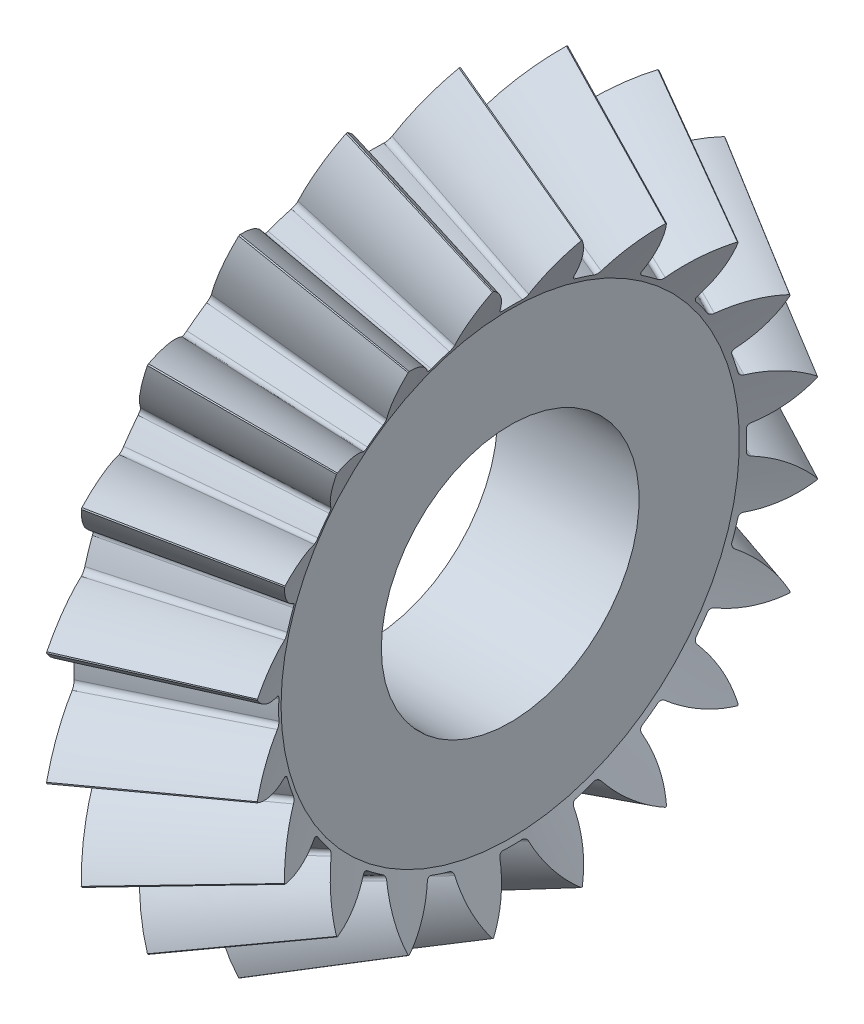
from build123d import *

# Parameters (mm, degrees)
TEETHCUTS_COUNT = 20
TEETHCUTS_ANGLE = 342
HUBSKE_R        = 22.642625335
HUB_DEPTH       = 0.0001016
BORSKE_R        = 10
BORE_DEPTH      = 51.178738133


with BuildPart() as part:
    # BasProSke → Base-Revolve (revolve)
    with BuildSketch(Plane(origin=(0, 0, 0), x_dir=(1, 0, 0), z_dir=(0, 1, 0)), mode=Mode.PRIVATE) as base_revolve_sk:
        Polygon((0, 0), (0, 22.642625335), (2.68244305, 28.007511429), (13.092769339, 21.995348277), (10.98614629, 17.782102184), (10.98614629, 0), align=None)
    revolve(base_revolve_sk.sketch.rotate(Axis((-10, 0, 0), (1, 0, 0)), 180), axis=Axis((-10, 0, 0), (1, 0, 0)))

    # ToothCut: read off the stored shape, not the designer's step
    # ToothCut: loft between two sections, ruled curve by curve
    toothcut_from = [
        Edge.make_bspline([(51.18205457, 0.006734473, -0.010227324), (51.179496811, 0.001618955, -0.014437914), (51.176344194, -0.00468628, -0.013574922), (51.174316199, -0.00874227, -0.008109037)], [0, 0, 0, 0, 1, 1, 1, 1], 3, [1, 0.818195495, 0.818195495, 1]),
        Edge.make_bspline([(51.174316199, -0.00874227, 0.008109037), (51.176344194, -0.00468628, 0.013574922), (51.179496811, 0.001618955, 0.014437914), (51.18205457, 0.006734473, 0.010227324)], [0, 0, 0, 0, 1, 1, 1, 1], 3, [1, 0.818195495, 0.818195495, 1]),
        Edge.make_bspline([(51.174316199, -0.00874227, -0.008109037), (51.173997864, -0.00937894, -0.007251055), (51.173732501, -0.009909666, -0.006307269), (51.173524678, -0.010325311, -0.005293924)], [0, 0, 0, 0, 1, 1, 1, 1], 3, [1, 0.994262316, 0.994262316, 1]),
        Edge.make_bspline([(51.173524678, -0.010325311, 0.005293924), (51.173732501, -0.009909666, 0.006307269), (51.173997864, -0.00937894, 0.007251055), (51.174316199, -0.00874227, 0.008109037)], [0, 0, 0, 0, 1, 1, 1, 1], 3, [1, 0.994262316, 0.994262316, 1]),
        Edge.make_bspline([(51.173524678, -0.010325311, -0.005293924), (51.172824252, -0.011726164, -0.00187864), (51.172824252, -0.011726164, 0.00187864), (51.173524678, -0.010325311, 0.005293924)], [0, 0, 0, 0, 1, 1, 1, 1], 3, [1, 0.939318578, 0.939318578, 1]),
        Edge.make_line((51.18205457, 0.006734473, 0.010227324), (51.18205457, 0.006734473, -0.010227324)),
    ]
    toothcut_to = [
        Edge.make_bspline([(2.752172869, 28.146971066, -4.861082262), (2.144262972, 26.931151275, -3.158754233), (1.327135782, 25.296896896, -1.972495955), (0.384332267, 23.411289869, -1.423587405)], [0, 0, 0, 0, 1, 1, 1, 1], 3, [1, 0.965920862, 0.965920862, 1]),
        Edge.make_bspline([(0.384332267, 23.411289869, 1.423587405), (1.327135782, 25.296896896, 1.972495955), (2.144262972, 26.931151275, 3.158754233), (2.752172869, 28.146971066, 4.861082262)], [0, 0, 0, 0, 1, 1, 1, 1], 3, [1, 0.965920862, 0.965920862, 1]),
        Edge.make_bspline([(0.384332267, 23.411289869, -1.423587405), (0.284221323, 23.21106798, -1.365301927), (0.222664658, 23.087954651, -1.17939311), (0.22694999, 23.096525314, -0.948273265)], [0, 0, 0, 0, 1, 1, 1, 1], 3, [1, 0.852235247, 0.852235247, 1]),
        Edge.make_bspline([(0.22694999, 23.096525314, 0.948273265), (0.222664658, 23.087954651, 1.17939311), (0.284221323, 23.21106798, 1.365301927), (0.384332267, 23.411289869, 1.423587405)], [0, 0, 0, 0, 1, 1, 1, 1], 3, [1, 0.852235247, 0.852235247, 1]),
        Edge.make_bspline([(0.22694999, 23.096525314, -0.948273265), (0.238668303, 23.119961941, -0.316272074), (0.238668303, 23.119961941, 0.316272074), (0.22694999, 23.096525314, 0.948273265)], [0, 0, 0, 0, 1, 1, 1, 1], 3, [1, 0.999427753, 0.999427753, 1]),
        Edge.make_line((2.752172869, 28.146971066, 4.861082262), (2.752172869, 28.146971066, -4.861082262)),
    ]
    toothcut = Solid(Shell([*[Face.make_surface_from_curves(toothcut_from[k], toothcut_to[k]) for k in range(6)], Face(Wire(toothcut_from)), Face(Wire(toothcut_to))]))
    add(toothcut, mode=Mode.SUBTRACT)

    # TeethCuts: ToothCut ×20 about axis
    teethcuts_axis = Axis((-10, 0, 0), (1, 0, 0))
    for i in range(1, TEETHCUTS_COUNT):
        add(toothcut.rotate(teethcuts_axis, i * TEETHCUTS_ANGLE / (TEETHCUTS_COUNT - 1)), mode=Mode.SUBTRACT)

    # HubSke → Hub (add)
    with BuildSketch(Plane.ZY):
        Circle(HUBSKE_R)
    extrude(amount=HUB_DEPTH)

    # BorSke → Bore (cut, symmetric)
    with BuildSketch(Plane(origin=(0, 0, 0), x_dir=(0, 0, -1), z_dir=(1, 0, 0))):
        with Locations(Location((0, 0, 0), (0, 0, 180))):
            Circle(BORSKE_R)
    extrude(amount=BORE_DEPTH, both=True, mode=Mode.SUBTRACT)


solid = part.part
